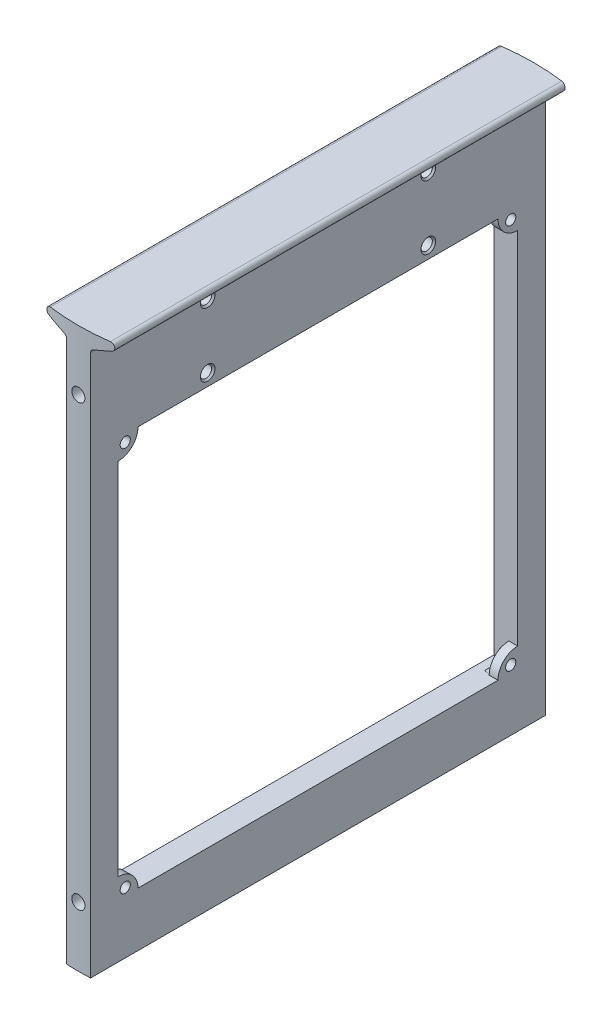
from build123d import *
from build123d.topology import SkipClean

# Parameters (mm, degrees)
BOSS_EXTRUDE1_DEPTH                  = 70
M4_TAPPED_HOLE1_D                    = 3.3
M4_TAPPED_HOLE1_DEPTH                = 11.5
M4_TAPPED_HOLE1_TIP                  = 0.991420021
M4_TAPPED_HOLE1_ON_FACE_2_D          = 3.3
M4_TAPPED_HOLE1_ON_FACE_2_DEPTH      = 11.5
M4_TAPPED_HOLE1_ON_FACE_2_TIP        = 0.991420021
BOSS_EXTRUDE3_REACH                  = 92.322
BOSS_EXTRUDE3_END_RADIUS             = 57
BOSS_EXTRUDE3_DIRECTION_2_REACH      = 92.322
BOSS_EXTRUDE3_DIRECTION_2_END_RADIUS = 57
CUT_EXTRUDE4_DEPTH                   = 91.671109116
CUT_EXTRUDE4_DEPTH_BACK              = 91.671109116
SKETCH5_W                            = 100
SKETCH5_H                            = 100
BOSS_EXTRUDE4_START                  = 0.8
SKETCH6_R                            = 1.27
BOSS_EXTRUDE4_DEPTH                  = 2.2
SKETCH12_R                           = 1.84
CUT_EXTRUDE6_DEPTH                   = 2.58


# Read off the part's stored shape, not the designer's step: Hole1
with BuildPart() as part:
    # Sketch1 → Boss-Extrude1 (new, symmetric)
    with BuildSketch(Plane(origin=(0, 0, 0), x_dir=(1, 0, 0), z_dir=(0, 1, 0))):
        with BuildLine():
            Line((-3, 56.920997883), (-3, -56.920997883))
            ThreePointArc((-3, -56.920997883), (0, -57), (3, -56.920997883))
            Line((3, -56.920997883), (3, 56.920997883))
            ThreePointArc((3, 56.920997883), (0, 57), (-3, 56.920997883))
        make_face()
    extrude(amount=BOSS_EXTRUDE1_DEPTH, both=True)

    # M4 Tapped Hole1
    with Locations(Plane(origin=(0, 55, 57), x_dir=(1, 0, 0), z_dir=(0, 0, 1))):
        with Locations((0, 0), (0, -110)):
            Hole(M4_TAPPED_HOLE1_D / 2, depth=M4_TAPPED_HOLE1_DEPTH)
            with Locations((0, 0, -(M4_TAPPED_HOLE1_DEPTH + M4_TAPPED_HOLE1_TIP / 2))):  # 118° drill point
                Cone(0, M4_TAPPED_HOLE1_D / 2, M4_TAPPED_HOLE1_TIP, mode=Mode.SUBTRACT)

    # M4 Tapped Hole1 on face 2
    with Locations(Plane(origin=(0, 55, -57), x_dir=(-1, 0, 0), z_dir=(0, 0, -1))):
        with Locations((0, 0), (0, -110)):
            Hole(M4_TAPPED_HOLE1_ON_FACE_2_D / 2, depth=M4_TAPPED_HOLE1_ON_FACE_2_DEPTH)
            with Locations((0, 0, -(M4_TAPPED_HOLE1_ON_FACE_2_DEPTH + M4_TAPPED_HOLE1_ON_FACE_2_TIP / 2))):  # 118° drill point
                Cone(0, M4_TAPPED_HOLE1_ON_FACE_2_D / 2, M4_TAPPED_HOLE1_ON_FACE_2_TIP, mode=Mode.SUBTRACT)

    # Boss-Extrude3: up to this cylinder (the profile starts inside it)
    with SkipClean():  # the faces are left unmerged after this step: merging them gives an invalid solid
        boss_extrude3_end = Plane(origin=(0, 67.695148, 0), z_dir=(0, -1, 0)) * Cylinder(BOSS_EXTRUDE3_END_RADIUS, 299.644, mode=Mode.PRIVATE)
        # Sketch4 → Boss-Extrude3 (add, up to the surface)
        with BuildSketch(Plane.XY, mode=Mode.PRIVATE) as boss_extrude3_sk1:
            with BuildLine():
                Line((-7.5, 70), (7.5, 70))
                ThreePointArc((7.5, 70), (8.48399318, 69.178206122), (7.850707217, 68.063514844))
                Line((7.850707217, 68.063514844), (3.649292783, 66.490114182))
                ThreePointArc((3.649292783, 66.490114182), (3.178200993, 66.123406518), (3, 65.553629026))
                Line((3, 65.553629026), (3, 64))
                Line((3, 64), (-3, 64))
                Line((-3, 64), (-3, 65.553629026))
                ThreePointArc((-3, 65.553629026), (-3.178200993, 66.123406518), (-3.649292783, 66.490114182))
                Line((-3.649292783, 66.490114182), (-7.850707217, 68.063514844))
                ThreePointArc((-7.850707217, 68.063514844), (-8.48399318, 69.178206122), (-7.5, 70))
            make_face()
        boss_extrude3_tool1 = extrude(boss_extrude3_sk1.sketch, amount=BOSS_EXTRUDE3_REACH, mode=Mode.PRIVATE) & boss_extrude3_end
        add(boss_extrude3_tool1.solids().sort_by_distance((0, 67.695148, 0))[0])

    # Boss-Extrude3 direction 2: up to this cylinder (the profile starts inside it)
    with SkipClean():  # the faces are left unmerged after this step: merging them gives an invalid solid
        boss_extrude3_direction_2_end = Plane(origin=(0, 67.695148, 0), z_dir=(0, -1, 0)) * Cylinder(BOSS_EXTRUDE3_DIRECTION_2_END_RADIUS, 299.644, mode=Mode.PRIVATE)
        # Sketch4 → Boss-Extrude3 direction 2 (add, up to the surface)
        with BuildSketch(Plane.XY, mode=Mode.PRIVATE) as boss_extrude3_direction_2_sk1:
            with BuildLine():
                Line((-7.5, 70), (7.5, 70))
                ThreePointArc((7.5, 70), (8.48399318, 69.178206122), (7.850707217, 68.063514844))
                Line((7.850707217, 68.063514844), (3.649292783, 66.490114182))
                ThreePointArc((3.649292783, 66.490114182), (3.178200993, 66.123406518), (3, 65.553629026))
                Line((3, 65.553629026), (3, 64))
                Line((3, 64), (-3, 64))
                Line((-3, 64), (-3, 65.553629026))
                ThreePointArc((-3, 65.553629026), (-3.178200993, 66.123406518), (-3.649292783, 66.490114182))
                Line((-3.649292783, 66.490114182), (-7.850707217, 68.063514844))
                ThreePointArc((-7.850707217, 68.063514844), (-8.48399318, 69.178206122), (-7.5, 70))
            make_face()
        boss_extrude3_direction_2_tool1 = extrude(boss_extrude3_direction_2_sk1.sketch, amount=-BOSS_EXTRUDE3_DIRECTION_2_REACH, mode=Mode.PRIVATE) & boss_extrude3_direction_2_end
        add(boss_extrude3_direction_2_tool1.solids().sort_by_distance((0, 67.695148, 0))[0])

    # Sketch5 → Cut-Extrude4 (cut, two sides: drawn at the far end of the back side and taken through both)
    with SkipClean():  # the faces are left unmerged after this step: merging them gives an invalid solid
        with BuildSketch(Plane(origin=(0, 0, 0), x_dir=(0, 0, -1), z_dir=(1, 0, 0)).offset(-CUT_EXTRUDE4_DEPTH_BACK)):
            with Locations((0, -6.446370974)):
                Rectangle(SKETCH5_W, SKETCH5_H)
        extrude(amount=CUT_EXTRUDE4_DEPTH + CUT_EXTRUDE4_DEPTH_BACK, mode=Mode.SUBTRACT)

    # Sketch6 → Boss-Extrude4 (add)
    # profile 1 of 4: a face of its own
    with SkipClean():  # the faces are left unmerged after this step: merging them gives an invalid solid
        with BuildSketch(Plane(origin=(0, 0, 0), x_dir=(0, 0, -1), z_dir=(1, 0, 0)).offset(BOSS_EXTRUDE4_START)):
            with BuildLine():
                Line((50, 43.553629026), (50, 38.603881557))
                ThreePointArc((50, 38.603881557), (46.5, 40.053629026), (45.050252532, 43.553629026))
                Line((45.050252532, 43.553629026), (50, 43.553629026))
            make_face()
            with Locations(Location((48.25, 41.803629026, 0), (0, 0, 180))):
                Circle(SKETCH6_R, mode=Mode.SUBTRACT)
        # profile 2 of 4: a face of its own
        with BuildSketch(Plane(origin=(0, 0, 0), x_dir=(0, 0, -1), z_dir=(1, 0, 0)).offset(BOSS_EXTRUDE4_START)):
            with BuildLine():
                Line((-50, 43.553629026), (-45.050252532, 43.553629026))
                ThreePointArc((-45.050252532, 43.553629026), (-46.5, 40.053629026), (-50, 38.603881557))
                Line((-50, 38.603881557), (-50, 43.553629026))
            make_face()
            with Locations(Location((-48.25, 41.803629026, 0), (0, 0, 180))):
                Circle(SKETCH6_R, mode=Mode.SUBTRACT)
        # profile 3 of 4: a face of its own
        with BuildSketch(Plane(origin=(0, 0, 0), x_dir=(0, 0, -1), z_dir=(1, 0, 0)).offset(BOSS_EXTRUDE4_START)):
            with BuildLine():
                Line((-50, -56.446370974), (-50, -51.496623506))
                ThreePointArc((-50, -51.496623506), (-46.5, -52.946370974), (-45.050252532, -56.446370974))
                Line((-45.050252532, -56.446370974), (-50, -56.446370974))
            make_face()
            with Locations(Location((-48.25, -54.696370974, 0), (0, 0, 180))):
                Circle(SKETCH6_R, mode=Mode.SUBTRACT)
        # profile 4 of 4: a face of its own
        with BuildSketch(Plane(origin=(0, 0, 0), x_dir=(0, 0, -1), z_dir=(1, 0, 0)).offset(BOSS_EXTRUDE4_START)):
            with BuildLine():
                Line((50, -56.446370974), (45.050252532, -56.446370974))
                ThreePointArc((45.050252532, -56.446370974), (46.5, -52.946370974), (50, -51.496623506))
                Line((50, -51.496623506), (50, -56.446370974))
            make_face()
            with Locations(Location((48.25, -54.696370974, 0), (0, 0, 180))):
                Circle(SKETCH6_R, mode=Mode.SUBTRACT)
        extrude(amount=BOSS_EXTRUDE4_DEPTH)

    # Hole1 outline → Hole1 (revolve, cut)
    with SkipClean():  # the faces are left unmerged after this step: merging them gives an invalid solid
        with BuildSketch(Plane(origin=(0, 46.553629026, -27.6225), x_dir=(0, 1, 0), z_dir=(0, 0, -1))):
            Polygon((0, -3), (1.42, -3), (1.42, 2.58), (1.84, 3), (0, 3), align=None)
        hole1 = revolve(axis=Axis((0, 46.553629026, -27.6225), (1, 0, 0)), mode=Mode.SUBTRACT)

    # Hole1 2 outline → Hole1 2 (revolve, cut)
    with SkipClean():  # the faces are left unmerged after this step: merging them gives an invalid solid
        with BuildSketch(Plane(origin=(0, 62.553629026, 27.6225), x_dir=(0, 1, 0), z_dir=(0, 0, -1))):
            Polygon((0, -3), (1.42, -3), (1.42, 2.58), (1.84, 3), (0, 3), align=None)
        hole1_2 = revolve(axis=Axis((0, 62.553629026, 27.6225), (1, 0, 0)), mode=Mode.SUBTRACT)

    # Hole1 3 outline → Hole1 3 (revolve, cut)
    with SkipClean():  # the faces are left unmerged after this step: merging them gives an invalid solid
        with BuildSketch(Plane(origin=(0, 46.553629026, 27.6225), x_dir=(0, 1, 0), z_dir=(0, 0, -1))):
            Polygon((0, -3), (1.42, -3), (1.42, 2.58), (1.84, 3), (0, 3), align=None)
        hole1_3 = revolve(axis=Axis((0, 46.553629026, 27.6225), (1, 0, 0)), mode=Mode.SUBTRACT)

    # Hole1 4 outline → Hole1 4 (revolve, cut)
    with SkipClean():  # the faces are left unmerged after this step: merging them gives an invalid solid
        with BuildSketch(Plane(origin=(0, 62.553629026, -27.6225), x_dir=(0, 1, 0), z_dir=(0, 0, -1))):
            Polygon((0, -3), (1.42, -3), (1.42, 2.58), (1.84, 3), (0, 3), align=None)
        hole1_4 = revolve(axis=Axis((0, 62.553629026, -27.6225), (1, 0, 0)), mode=Mode.SUBTRACT)

    # Mirror1: Hole1, Hole1 2, Hole1 3, Hole1 4 across plane
    with SkipClean():  # the faces are left unmerged after this step: merging them gives an invalid solid
        add(hole1.mirror(Plane(origin=(0, 0, 0), x_dir=(0, 0, 1), z_dir=(1, 0, 0))), mode=Mode.SUBTRACT)
        add(hole1_2.mirror(Plane(origin=(0, 0, 0), x_dir=(0, 0, 1), z_dir=(1, 0, 0))), mode=Mode.SUBTRACT)
        add(hole1_3.mirror(Plane(origin=(0, 0, 0), x_dir=(0, 0, 1), z_dir=(1, 0, 0))), mode=Mode.SUBTRACT)
        add(hole1_4.mirror(Plane(origin=(0, 0, 0), x_dir=(0, 0, 1), z_dir=(1, 0, 0))), mode=Mode.SUBTRACT)

    # Sketch12 → Cut-Extrude6 (cut, symmetric)
    with SkipClean():  # the faces are left unmerged after this step: merging them gives an invalid solid
        with BuildSketch(Plane(origin=(0, 0, 0), x_dir=(0, 0, -1), z_dir=(1, 0, 0))):
            with Locations((-27.6225, 62.553629026)):
                Circle(SKETCH12_R)
            with Locations((-27.6225, 46.553629026)):
                Circle(SKETCH12_R)
            with Locations((27.6225, 62.553629026)):
                Circle(SKETCH12_R)
            with Locations((27.6225, 46.553629026)):
                Circle(SKETCH12_R)
        extrude(amount=CUT_EXTRUDE6_DEPTH, both=True, mode=Mode.SUBTRACT)


solid = part.part
